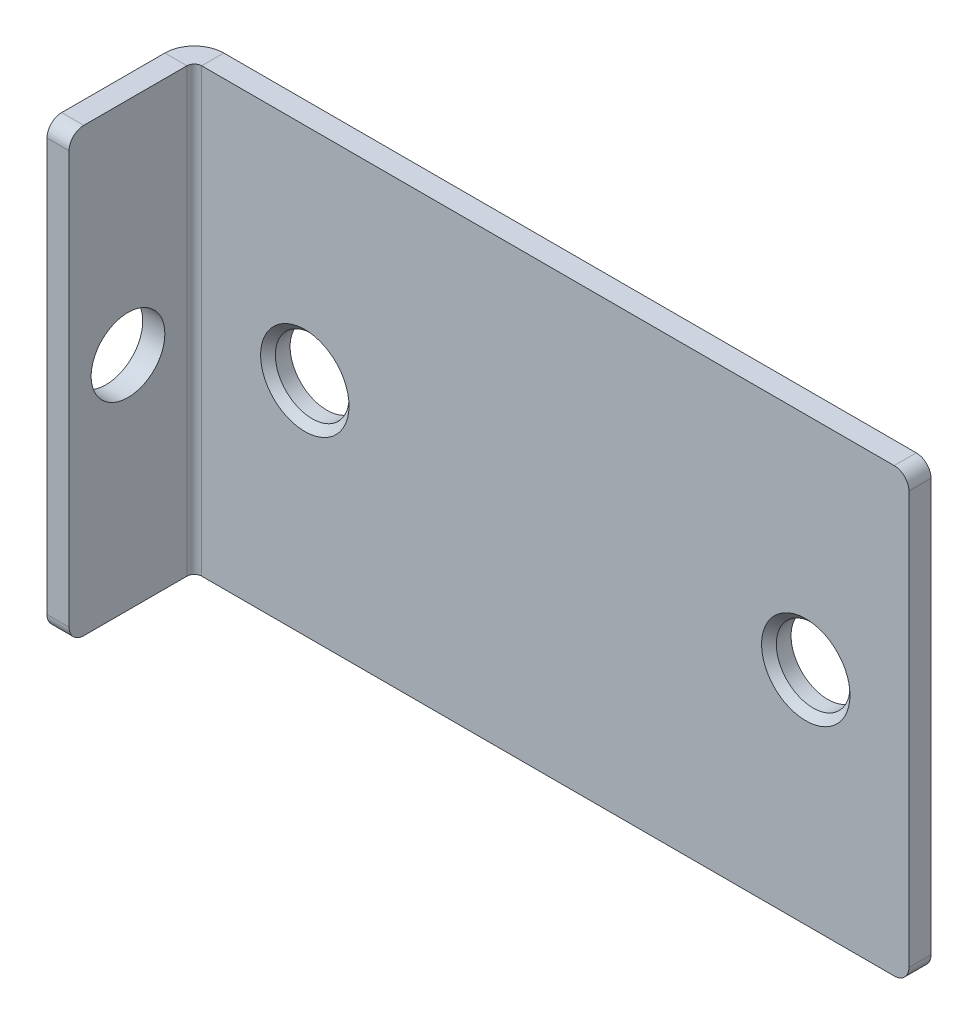
from build123d import *

# Parameters (mm, degrees)
SKETCH2_W                                      = 5
SKETCH2_H                                      = 3
BASE_FLANGE1_DEPTH                             = 0.15
EDGE_FLANGE1_STRIP_W                           = 0.7
EDGE_FLANGE1_STRIP_H                           = 0.15
EDGE_FLANGE1_STRIP_CUT_DEPTH                   = 3
EDGE_FLANGE1_DEPTH                             = 3
SKETCH14_R                                     = 0.25
CUT_EXTRUDE1_DEPTH                             = 7.095475053
CSK_FOR_M2_FLAT_HEAD_MACHINE_SCREW1_AT_2_COUNT = 2
CSK_FOR_M2_FLAT_HEAD_MACHINE_SCREW1_AT_2_PITCH = 3.4
FILLET1_R                                      = 0.1


# Sheet-metal steps are written as plain solids
with BuildPart() as part:
    # Sketch2 → Base-Flange1 (new body)
    with BuildSketch(Plane.XY):
        with Locations((2.5, 2.093023256)):
            Rectangle(SKETCH2_W, SKETCH2_H)
    extrude(amount=-BASE_FLANGE1_DEPTH)

    # Edge-Flange1 strip (across the edge) → Edge-Flange1 strip cut (cut)
    with BuildSketch(Plane.XZ.offset(-3.593023256)):
        with Locations((-0.15, -0.075)):
            Rectangle(EDGE_FLANGE1_STRIP_W, EDGE_FLANGE1_STRIP_H)
    extrude(amount=EDGE_FLANGE1_STRIP_CUT_DEPTH, mode=Mode.SUBTRACT)

    # Edge-Flange1 section (across the edge) → Edge-Flange1 (add)
    with BuildSketch(Plane.XZ.offset(-3.593023256)):
        with BuildLine():
            Line((0, 0.05), (0, 0.85))
            Line((0, 0.85), (0.15, 0.85))
            Line((0.15, 0.85), (0.15, 0.05))
            ThreePointArc((0.15, 0.05), (0.164644661, 0.014644661), (0.2, 0))
            Line((0.2, 0), (0.2, -0.15))
            ThreePointArc((0.2, -0.15), (0.058578644, -0.091421356), (0, 0.05))
        make_face()
    extrude(amount=EDGE_FLANGE1_DEPTH)

    # Sketch14 → Cut-Extrude1 (cut, through all)
    with BuildSketch(Plane(origin=(0.15, 0, 0), x_dir=(0, 0, -1), z_dir=(1, 0, 0))):
        with Locations((-0.45, 2.093023256)):
            Circle(SKETCH14_R)
    extrude(amount=-CUT_EXTRUDE1_DEPTH, mode=Mode.SUBTRACT)

    # Sketch17 → CSK for M2 Flat Head Machine Screw1 (revolve, cut)
    with BuildSketch(Plane(origin=(0.9, 2.093023256, 0), x_dir=(0, -1, 0), z_dir=(1, 0, 0))):
        Polygon((0, 0), (0, 0.15), (0.25, 0.15), (0.25, 0.05), (0.3, 0), align=None)
    csk_for_m2_flat_head_machine_screw1 = revolve(axis=Axis((0.9, 2.093023256, 6.35), (0, 0, -1)), mode=Mode.SUBTRACT)

    # CSK for M2 Flat Head Machine Screw1 at 2: CSK for M2 Flat Head Machine Screw1 ×2
    with Locations(*[(i * CSK_FOR_M2_FLAT_HEAD_MACHINE_SCREW1_AT_2_PITCH, 0, 0) for i in range(1, CSK_FOR_M2_FLAT_HEAD_MACHINE_SCREW1_AT_2_COUNT)]):
        add(csk_for_m2_flat_head_machine_screw1, mode=Mode.SUBTRACT)

    # Fillet1
    fillet1_edges = [part.edges().sort_by_distance(p)[0] for p in [
        (0.075, 3.593023256, 0.85),
        (0.075, 0.593023256, 0.85),
        (5, 3.593023256, -0.075),
        (5, 0.593023256, -0.075),
    ]]
    fillet(fillet1_edges, radius=FILLET1_R)


solid = part.part
